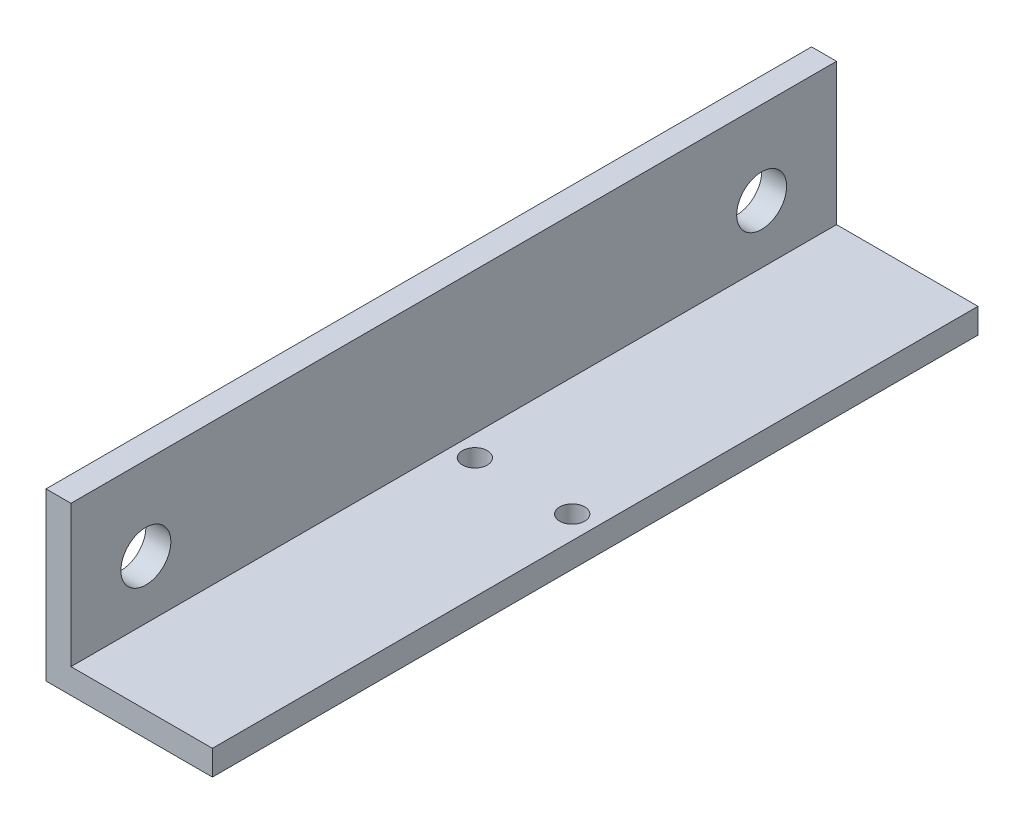
from build123d import *

# Parameters (mm, degrees)
EXTRUDE_THIN1_DEPTH = 46
SKETCH2_R           = 0.75
CUT_EXTRUDE1_DEPTH  = 48.835656157
SKETCH3_R           = 1.5
CUT_EXTRUDE2_DEPTH  = 49.124837662


with BuildPart() as part:
    # Sketch1 → Extrude-Thin1 (new body)
    with BuildSketch(Plane.XY):
        Polygon((0, 10), (0, 0), (10, 0), (10, 1.5), (1.5, 1.5), (1.5, 10), align=None)
    extrude(amount=EXTRUDE_THIN1_DEPTH)

    # Sketch2 → Cut-Extrude1 (cut, through all)
    with BuildSketch(Plane(origin=(0, 1.5, 0), x_dir=(1, 0, 0), z_dir=(0, 1, 0))):
        with Locations((8.618813188, -23)):
            Circle(SKETCH2_R)
        with Locations((2.768813188, -23)):
            Circle(SKETCH2_R)
    extrude(amount=-CUT_EXTRUDE1_DEPTH, mode=Mode.SUBTRACT)

    # Sketch3 → Cut-Extrude2 (cut, through all)
    with BuildSketch(Plane.ZY):
        with Locations((41.5, 5)):
            Circle(SKETCH3_R)
        with Locations((4.5, 5)):
            Circle(SKETCH3_R)
    extrude(amount=-CUT_EXTRUDE2_DEPTH, mode=Mode.SUBTRACT)


solid = part.part
